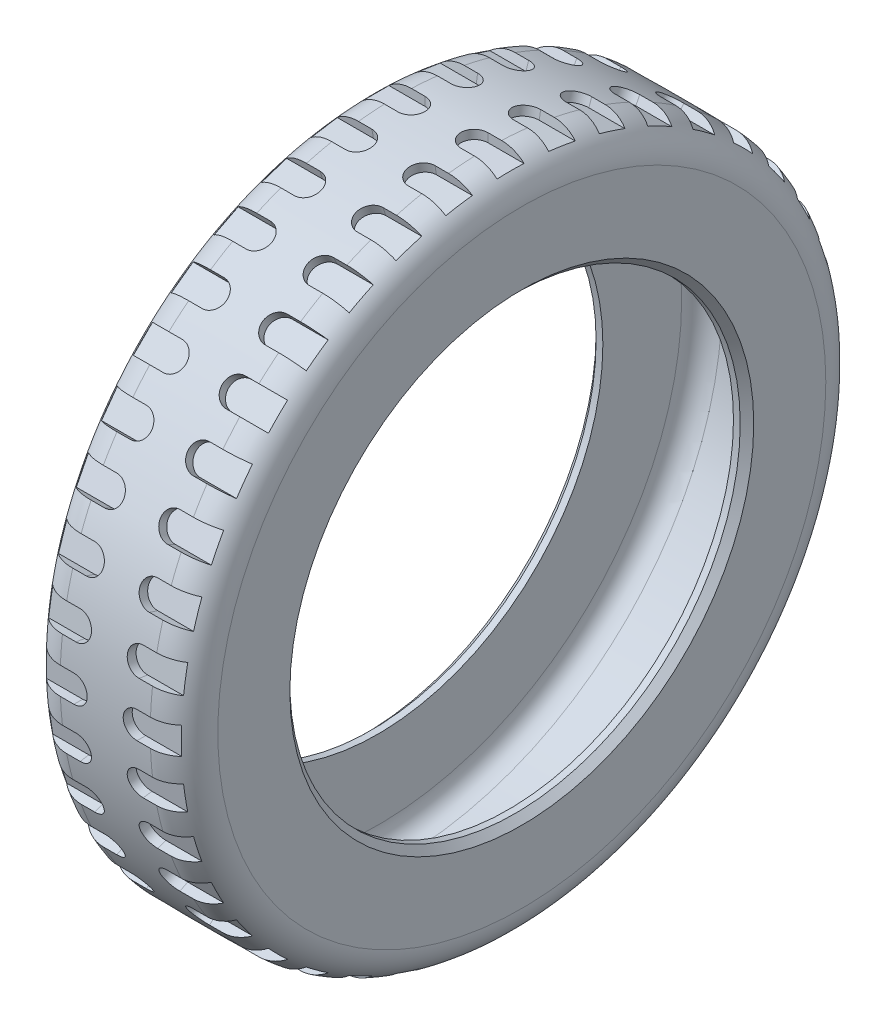
from build123d import *

# Parameters (mm, degrees)
PAH1_SIZE               = 1.5
KES_EKSTR_ZYON1_DEPTH   = 2
DAIRESEL_KAPLAMA1_COUNT = 40
AYNALAMA1_COPY_1_DEPTH  = 2
AYNALAMA1_COPY_2_DEPTH  = 2
AYNALAMA1_COPY_3_DEPTH  = 2
AYNALAMA1_COPY_4_DEPTH  = 2
AYNALAMA1_COPY_5_DEPTH  = 2
AYNALAMA1_COPY_6_DEPTH  = 2
AYNALAMA1_COPY_7_DEPTH  = 2
AYNALAMA1_COPY_8_DEPTH  = 2
AYNALAMA1_COPY_9_DEPTH  = 2
AYNALAMA1_COPY_10_DEPTH = 2
AYNALAMA1_COPY_11_DEPTH = 2
AYNALAMA1_COPY_12_DEPTH = 2
AYNALAMA1_COPY_13_DEPTH = 2
AYNALAMA1_COPY_14_DEPTH = 2
AYNALAMA1_COPY_15_DEPTH = 2
AYNALAMA1_COPY_16_DEPTH = 2
AYNALAMA1_COPY_17_DEPTH = 2
AYNALAMA1_COPY_18_DEPTH = 2
AYNALAMA1_COPY_19_DEPTH = 2
AYNALAMA1_COPY_20_DEPTH = 2
AYNALAMA1_COPY_21_DEPTH = 2
AYNALAMA1_COPY_22_DEPTH = 2
AYNALAMA1_COPY_23_DEPTH = 2
AYNALAMA1_COPY_24_DEPTH = 2
AYNALAMA1_COPY_25_DEPTH = 2
AYNALAMA1_COPY_26_DEPTH = 2
AYNALAMA1_COPY_27_DEPTH = 2
AYNALAMA1_COPY_28_DEPTH = 2
AYNALAMA1_COPY_29_DEPTH = 2
AYNALAMA1_COPY_30_DEPTH = 2
AYNALAMA1_COPY_31_DEPTH = 2
AYNALAMA1_COPY_32_DEPTH = 2
AYNALAMA1_COPY_33_DEPTH = 2
AYNALAMA1_COPY_34_DEPTH = 2
AYNALAMA1_COPY_35_DEPTH = 2
AYNALAMA1_COPY_36_DEPTH = 2
AYNALAMA1_COPY_37_DEPTH = 2
AYNALAMA1_COPY_38_DEPTH = 2
AYNALAMA1_COPY_39_DEPTH = 2
AYNALAMA1_COPY_40_DEPTH = 2


with BuildPart() as part:
    # Çizim1 → Döndür1 (revolve)
    with BuildSketch(Plane.XY):
        with BuildLine():
            Line((-17.5, 50), (-17.5, 67.5))
            ThreePointArc((-17.5, 67.5), (-15.303300859, 72.803300859), (-10, 75))
            Line((-10, 75), (10, 75))
            ThreePointArc((10, 75), (15.303300859, 72.803300859), (17.5, 67.5))
            Line((17.5, 67.5), (17.5, 50))
            Line((17.5, 50), (14.5, 50))
            Line((14.5, 50), (14.5, 67.5))
            ThreePointArc((14.5, 67.5), (13.181980515, 70.681980515), (10, 72))
            Line((10, 72), (-10, 72))
            ThreePointArc((-10, 72), (-13.181980515, 70.681980515), (-14.5, 67.5))
            Line((-14.5, 67.5), (-14.5, 50))
            Line((-14.5, 50), (-17.5, 50))
        make_face()
    revolve(axis=Axis((0, 0, 0), (-1, 0, 0)))

    # Pah1
    pah1_edges = [part.edges().sort_by_distance(p)[0] for p in [
        (-17.5, -50, 0),
        (17.5, -50, 0),
    ]]
    chamfer(pah1_edges, length=PAH1_SIZE)

    # Çizim2 → Kes-Ekstrüzyon1 (cut)
    with BuildSketch(Plane(origin=(0, 75, 0), x_dir=(1, 0, 0), z_dir=(0, 1, 0))):
        with BuildLine():
            Line((7, 3), (15, 3))
            Line((15, 3), (15, -3))
            Line((15, -3), (7, -3))
            ThreePointArc((7, -3), (4, 0), (7, 3))
        make_face()
    kes_ekstr_zyon1 = extrude(amount=-KES_EKSTR_ZYON1_DEPTH, mode=Mode.SUBTRACT)

    # Dairesel Kaplama1: Kes-Ekstrüzyon1 ×40 about axis
    dairesel_kaplama1_axis = Axis((14.5, 0, 0), (1, 0, 0))
    for i in range(1, DAIRESEL_KAPLAMA1_COUNT):
        add(kes_ekstr_zyon1.rotate(dairesel_kaplama1_axis, i * 360 / DAIRESEL_KAPLAMA1_COUNT), mode=Mode.SUBTRACT)

    # Aynalama1 copy 1 sketch → Aynalama1 copy 1 (cut)
    with BuildSketch(Plane(origin=(0, 74.076625545, 11.732584878), x_dir=(-1, 0, 0), z_dir=(0, 0.9876883405951378, 0.15643446504023087))):
        with BuildLine():
            Line((7, -3), (15, -3))
            Line((15, -3), (15, 3))
            Line((15, 3), (7, 3))
            ThreePointArc((7, 3), (4, 0), (7, -3))
        make_face()
    extrude(amount=-AYNALAMA1_COPY_1_DEPTH, mode=Mode.SUBTRACT)

    # Aynalama1 copy 2 sketch → Aynalama1 copy 2 (cut)
    with BuildSketch(Plane(origin=(0, 71.329238722, 23.176274578), x_dir=(-1, 0, 0), z_dir=(0, 0.9510565162951535, 0.3090169943749474))):
        with BuildLine():
            Line((7, -3), (15, -3))
            Line((15, -3), (15, 3))
            Line((15, 3), (7, 3))
            ThreePointArc((7, 3), (4, 0), (7, -3))
        make_face()
    extrude(amount=-AYNALAMA1_COPY_2_DEPTH, mode=Mode.SUBTRACT)

    # Aynalama1 copy 3 sketch → Aynalama1 copy 3 (cut)
    with BuildSketch(Plane(origin=(0, 66.825489314, 34.04928748), x_dir=(-1, 0, 0), z_dir=(0, 0.8910065241883679, 0.45399049973954675))):
        with BuildLine():
            Line((7, -3), (15, -3))
            Line((15, -3), (15, 3))
            Line((15, 3), (7, 3))
            ThreePointArc((7, 3), (4, 0), (7, -3))
        make_face()
    extrude(amount=-AYNALAMA1_COPY_3_DEPTH, mode=Mode.SUBTRACT)

    # Aynalama1 copy 4 sketch → Aynalama1 copy 4 (cut)
    with BuildSketch(Plane(origin=(0, 60.676274578, 44.083893922), x_dir=(-1, 0, 0), z_dir=(0, 0.8090169943749475, 0.5877852522924731))):
        with BuildLine():
            Line((7, -3), (15, -3))
            Line((15, -3), (15, 3))
            Line((15, 3), (7, 3))
            ThreePointArc((7, 3), (4, 0), (7, -3))
        make_face()
    extrude(amount=-AYNALAMA1_COPY_4_DEPTH, mode=Mode.SUBTRACT)

    # Aynalama1 copy 5 sketch → Aynalama1 copy 5 (cut)
    with BuildSketch(Plane(origin=(0, 53.033008589, 53.033008589), x_dir=(-1, 0, 0), z_dir=(0, 0.7071067811865476, 0.7071067811865475))):
        with BuildLine():
            Line((7, -3), (15, -3))
            Line((15, -3), (15, 3))
            Line((15, 3), (7, 3))
            ThreePointArc((7, 3), (4, 0), (7, -3))
        make_face()
    extrude(amount=-AYNALAMA1_COPY_5_DEPTH, mode=Mode.SUBTRACT)

    # Aynalama1 copy 6 sketch → Aynalama1 copy 6 (cut)
    with BuildSketch(Plane(origin=(0, 44.083893922, 60.676274578), x_dir=(-1, 0, 0), z_dir=(0, 0.5877852522924731, 0.8090169943749475))):
        with BuildLine():
            Line((7, -3), (15, -3))
            Line((15, -3), (15, 3))
            Line((15, 3), (7, 3))
            ThreePointArc((7, 3), (4, 0), (7, -3))
        make_face()
    extrude(amount=-AYNALAMA1_COPY_6_DEPTH, mode=Mode.SUBTRACT)

    # Aynalama1 copy 7 sketch → Aynalama1 copy 7 (cut)
    with BuildSketch(Plane(origin=(0, 34.04928748, 66.825489314), x_dir=(-1, 0, 0), z_dir=(0, 0.4539904997395468, 0.8910065241883678))):
        with BuildLine():
            Line((7, -3), (15, -3))
            Line((15, -3), (15, 3))
            Line((15, 3), (7, 3))
            ThreePointArc((7, 3), (4, 0), (7, -3))
        make_face()
    extrude(amount=-AYNALAMA1_COPY_7_DEPTH, mode=Mode.SUBTRACT)

    # Aynalama1 copy 8 sketch → Aynalama1 copy 8 (cut)
    with BuildSketch(Plane(origin=(0, 23.176274578, 71.329238722), x_dir=(-1, 0, 0), z_dir=(0, 0.30901699437494745, 0.9510565162951535))):
        with BuildLine():
            Line((7, -3), (15, -3))
            Line((15, -3), (15, 3))
            Line((15, 3), (7, 3))
            ThreePointArc((7, 3), (4, 0), (7, -3))
        make_face()
    extrude(amount=-AYNALAMA1_COPY_8_DEPTH, mode=Mode.SUBTRACT)

    # Aynalama1 copy 9 sketch → Aynalama1 copy 9 (cut)
    with BuildSketch(Plane(origin=(0, 11.732584878, 74.076625545), x_dir=(-1, 0, 0), z_dir=(0, 0.15643446504023092, 0.9876883405951378))):
        with BuildLine():
            Line((7, -3), (15, -3))
            Line((15, -3), (15, 3))
            Line((15, 3), (7, 3))
            ThreePointArc((7, 3), (4, 0), (7, -3))
        make_face()
    extrude(amount=-AYNALAMA1_COPY_9_DEPTH, mode=Mode.SUBTRACT)

    # Aynalama1 copy 10 sketch → Aynalama1 copy 10 (cut)
    with BuildSketch(Plane(origin=(0, 0, 75), x_dir=(-1, 0, 0), z_dir=(0, 0, 1))):
        with BuildLine():
            Line((7, -3), (15, -3))
            Line((15, -3), (15, 3))
            Line((15, 3), (7, 3))
            ThreePointArc((7, 3), (4, 0), (7, -3))
        make_face()
    extrude(amount=-AYNALAMA1_COPY_10_DEPTH, mode=Mode.SUBTRACT)

    # Aynalama1 copy 11 sketch → Aynalama1 copy 11 (cut)
    with BuildSketch(Plane(origin=(0, -11.732584878, 74.076625545), x_dir=(-1, 0, 0), z_dir=(0, -0.1564344650402308, 0.9876883405951378))):
        with BuildLine():
            Line((7, -3), (15, -3))
            Line((15, -3), (15, 3))
            Line((15, 3), (7, 3))
            ThreePointArc((7, 3), (4, 0), (7, -3))
        make_face()
    extrude(amount=-AYNALAMA1_COPY_11_DEPTH, mode=Mode.SUBTRACT)

    # Aynalama1 copy 12 sketch → Aynalama1 copy 12 (cut)
    with BuildSketch(Plane(origin=(0, -23.176274578, 71.329238722), x_dir=(-1, 0, 0), z_dir=(0, -0.30901699437494734, 0.9510565162951536))):
        with BuildLine():
            Line((7, -3), (15, -3))
            Line((15, -3), (15, 3))
            Line((15, 3), (7, 3))
            ThreePointArc((7, 3), (4, 0), (7, -3))
        make_face()
    extrude(amount=-AYNALAMA1_COPY_12_DEPTH, mode=Mode.SUBTRACT)

    # Aynalama1 copy 13 sketch → Aynalama1 copy 13 (cut)
    with BuildSketch(Plane(origin=(0, -34.04928748, 66.825489314), x_dir=(-1, 0, 0), z_dir=(0, -0.4539904997395467, 0.8910065241883679))):
        with BuildLine():
            Line((7, -3), (15, -3))
            Line((15, -3), (15, 3))
            Line((15, 3), (7, 3))
            ThreePointArc((7, 3), (4, 0), (7, -3))
        make_face()
    extrude(amount=-AYNALAMA1_COPY_13_DEPTH, mode=Mode.SUBTRACT)

    # Aynalama1 copy 14 sketch → Aynalama1 copy 14 (cut)
    with BuildSketch(Plane(origin=(0, -44.083893922, 60.676274578), x_dir=(-1, 0, 0), z_dir=(0, -0.587785252292473, 0.8090169943749475))):
        with BuildLine():
            Line((7, -3), (15, -3))
            Line((15, -3), (15, 3))
            Line((15, 3), (7, 3))
            ThreePointArc((7, 3), (4, 0), (7, -3))
        make_face()
    extrude(amount=-AYNALAMA1_COPY_14_DEPTH, mode=Mode.SUBTRACT)

    # Aynalama1 copy 15 sketch → Aynalama1 copy 15 (cut)
    with BuildSketch(Plane(origin=(0, -53.033008589, 53.033008589), x_dir=(-1, 0, 0), z_dir=(0, -0.7071067811865475, 0.7071067811865476))):
        with BuildLine():
            Line((7, -3), (15, -3))
            Line((15, -3), (15, 3))
            Line((15, 3), (7, 3))
            ThreePointArc((7, 3), (4, 0), (7, -3))
        make_face()
    extrude(amount=-AYNALAMA1_COPY_15_DEPTH, mode=Mode.SUBTRACT)

    # Aynalama1 copy 16 sketch → Aynalama1 copy 16 (cut)
    with BuildSketch(Plane(origin=(0, -60.676274578, 44.083893922), x_dir=(-1, 0, 0), z_dir=(0, -0.8090169943749473, 0.5877852522924732))):
        with BuildLine():
            Line((7, -3), (15, -3))
            Line((15, -3), (15, 3))
            Line((15, 3), (7, 3))
            ThreePointArc((7, 3), (4, 0), (7, -3))
        make_face()
    extrude(amount=-AYNALAMA1_COPY_16_DEPTH, mode=Mode.SUBTRACT)

    # Aynalama1 copy 17 sketch → Aynalama1 copy 17 (cut)
    with BuildSketch(Plane(origin=(0, -66.825489314, 34.04928748), x_dir=(-1, 0, 0), z_dir=(0, -0.8910065241883678, 0.45399049973954686))):
        with BuildLine():
            Line((7, -3), (15, -3))
            Line((15, -3), (15, 3))
            Line((15, 3), (7, 3))
            ThreePointArc((7, 3), (4, 0), (7, -3))
        make_face()
    extrude(amount=-AYNALAMA1_COPY_17_DEPTH, mode=Mode.SUBTRACT)

    # Aynalama1 copy 18 sketch → Aynalama1 copy 18 (cut)
    with BuildSketch(Plane(origin=(0, -71.329238722, 23.176274578), x_dir=(-1, 0, 0), z_dir=(0, -0.9510565162951535, 0.3090169943749475))):
        with BuildLine():
            Line((7, -3), (15, -3))
            Line((15, -3), (15, 3))
            Line((15, 3), (7, 3))
            ThreePointArc((7, 3), (4, 0), (7, -3))
        make_face()
    extrude(amount=-AYNALAMA1_COPY_18_DEPTH, mode=Mode.SUBTRACT)

    # Aynalama1 copy 19 sketch → Aynalama1 copy 19 (cut)
    with BuildSketch(Plane(origin=(0, -74.076625545, 11.732584878), x_dir=(-1, 0, 0), z_dir=(0, -0.9876883405951377, 0.15643446504023098))):
        with BuildLine():
            Line((7, -3), (15, -3))
            Line((15, -3), (15, 3))
            Line((15, 3), (7, 3))
            ThreePointArc((7, 3), (4, 0), (7, -3))
        make_face()
    extrude(amount=-AYNALAMA1_COPY_19_DEPTH, mode=Mode.SUBTRACT)

    # Aynalama1 copy 20 sketch → Aynalama1 copy 20 (cut)
    with BuildSketch(Plane(origin=(0, -75, 0), x_dir=(-1, 0, 0), z_dir=(0, -1, 0))):
        with BuildLine():
            Line((7, -3), (15, -3))
            Line((15, -3), (15, 3))
            Line((15, 3), (7, 3))
            ThreePointArc((7, 3), (4, 0), (7, -3))
        make_face()
    extrude(amount=-AYNALAMA1_COPY_20_DEPTH, mode=Mode.SUBTRACT)

    # Aynalama1 copy 21 sketch → Aynalama1 copy 21 (cut)
    with BuildSketch(Plane(origin=(0, -74.076625545, -11.732584878), x_dir=(-1, 0, 0), z_dir=(0, -0.9876883405951378, -0.15643446504023073))):
        with BuildLine():
            Line((7, -3), (15, -3))
            Line((15, -3), (15, 3))
            Line((15, 3), (7, 3))
            ThreePointArc((7, 3), (4, 0), (7, -3))
        make_face()
    extrude(amount=-AYNALAMA1_COPY_21_DEPTH, mode=Mode.SUBTRACT)

    # Aynalama1 copy 22 sketch → Aynalama1 copy 22 (cut)
    with BuildSketch(Plane(origin=(0, -71.329238722, -23.176274578), x_dir=(-1, 0, 0), z_dir=(0, -0.9510565162951536, -0.3090169943749473))):
        with BuildLine():
            Line((7, -3), (15, -3))
            Line((15, -3), (15, 3))
            Line((15, 3), (7, 3))
            ThreePointArc((7, 3), (4, 0), (7, -3))
        make_face()
    extrude(amount=-AYNALAMA1_COPY_22_DEPTH, mode=Mode.SUBTRACT)

    # Aynalama1 copy 23 sketch → Aynalama1 copy 23 (cut)
    with BuildSketch(Plane(origin=(0, -66.825489314, -34.04928748), x_dir=(-1, 0, 0), z_dir=(0, -0.8910065241883679, -0.4539904997395467))):
        with BuildLine():
            Line((7, -3), (15, -3))
            Line((15, -3), (15, 3))
            Line((15, 3), (7, 3))
            ThreePointArc((7, 3), (4, 0), (7, -3))
        make_face()
    extrude(amount=-AYNALAMA1_COPY_23_DEPTH, mode=Mode.SUBTRACT)

    # Aynalama1 copy 24 sketch → Aynalama1 copy 24 (cut)
    with BuildSketch(Plane(origin=(0, -60.676274578, -44.083893922), x_dir=(-1, 0, 0), z_dir=(0, -0.8090169943749476, -0.587785252292473))):
        with BuildLine():
            Line((7, -3), (15, -3))
            Line((15, -3), (15, 3))
            Line((15, 3), (7, 3))
            ThreePointArc((7, 3), (4, 0), (7, -3))
        make_face()
    extrude(amount=-AYNALAMA1_COPY_24_DEPTH, mode=Mode.SUBTRACT)

    # Aynalama1 copy 25 sketch → Aynalama1 copy 25 (cut)
    with BuildSketch(Plane(origin=(0, -53.033008589, -53.033008589), x_dir=(-1, 0, 0), z_dir=(0, -0.7071067811865477, -0.7071067811865475))):
        with BuildLine():
            Line((7, -3), (15, -3))
            Line((15, -3), (15, 3))
            Line((15, 3), (7, 3))
            ThreePointArc((7, 3), (4, 0), (7, -3))
        make_face()
    extrude(amount=-AYNALAMA1_COPY_25_DEPTH, mode=Mode.SUBTRACT)

    # Aynalama1 copy 26 sketch → Aynalama1 copy 26 (cut)
    with BuildSketch(Plane(origin=(0, -44.083893922, -60.676274578), x_dir=(-1, 0, 0), z_dir=(0, -0.5877852522924732, -0.8090169943749473))):
        with BuildLine():
            Line((7, -3), (15, -3))
            Line((15, -3), (15, 3))
            Line((15, 3), (7, 3))
            ThreePointArc((7, 3), (4, 0), (7, -3))
        make_face()
    extrude(amount=-AYNALAMA1_COPY_26_DEPTH, mode=Mode.SUBTRACT)

    # Aynalama1 copy 27 sketch → Aynalama1 copy 27 (cut)
    with BuildSketch(Plane(origin=(0, -34.04928748, -66.825489314), x_dir=(-1, 0, 0), z_dir=(0, -0.4539904997395469, -0.8910065241883678))):
        with BuildLine():
            Line((7, -3), (15, -3))
            Line((15, -3), (15, 3))
            Line((15, 3), (7, 3))
            ThreePointArc((7, 3), (4, 0), (7, -3))
        make_face()
    extrude(amount=-AYNALAMA1_COPY_27_DEPTH, mode=Mode.SUBTRACT)

    # Aynalama1 copy 28 sketch → Aynalama1 copy 28 (cut)
    with BuildSketch(Plane(origin=(0, -23.176274578, -71.329238722), x_dir=(-1, 0, 0), z_dir=(0, -0.30901699437494756, -0.9510565162951535))):
        with BuildLine():
            Line((7, -3), (15, -3))
            Line((15, -3), (15, 3))
            Line((15, 3), (7, 3))
            ThreePointArc((7, 3), (4, 0), (7, -3))
        make_face()
    extrude(amount=-AYNALAMA1_COPY_28_DEPTH, mode=Mode.SUBTRACT)

    # Aynalama1 copy 29 sketch → Aynalama1 copy 29 (cut)
    with BuildSketch(Plane(origin=(0, -11.732584878, -74.076625545), x_dir=(-1, 0, 0), z_dir=(0, -0.15643446504023104, -0.9876883405951377))):
        with BuildLine():
            Line((7, -3), (15, -3))
            Line((15, -3), (15, 3))
            Line((15, 3), (7, 3))
            ThreePointArc((7, 3), (4, 0), (7, -3))
        make_face()
    extrude(amount=-AYNALAMA1_COPY_29_DEPTH, mode=Mode.SUBTRACT)

    # Aynalama1 copy 30 sketch → Aynalama1 copy 30 (cut)
    with BuildSketch(Plane(origin=(0, 0, -75), x_dir=(-1, 0, 0), z_dir=(0, 0, -1))):
        with BuildLine():
            Line((7, -3), (15, -3))
            Line((15, -3), (15, 3))
            Line((15, 3), (7, 3))
            ThreePointArc((7, 3), (4, 0), (7, -3))
        make_face()
    extrude(amount=-AYNALAMA1_COPY_30_DEPTH, mode=Mode.SUBTRACT)

    # Aynalama1 copy 31 sketch → Aynalama1 copy 31 (cut)
    with BuildSketch(Plane(origin=(0, 11.732584878, -74.076625545), x_dir=(-1, 0, 0), z_dir=(0, 0.15643446504023067, -0.9876883405951378))):
        with BuildLine():
            Line((7, -3), (15, -3))
            Line((15, -3), (15, 3))
            Line((15, 3), (7, 3))
            ThreePointArc((7, 3), (4, 0), (7, -3))
        make_face()
    extrude(amount=-AYNALAMA1_COPY_31_DEPTH, mode=Mode.SUBTRACT)

    # Aynalama1 copy 32 sketch → Aynalama1 copy 32 (cut)
    with BuildSketch(Plane(origin=(0, 23.176274578, -71.329238722), x_dir=(-1, 0, 0), z_dir=(0, 0.30901699437494723, -0.9510565162951536))):
        with BuildLine():
            Line((7, -3), (15, -3))
            Line((15, -3), (15, 3))
            Line((15, 3), (7, 3))
            ThreePointArc((7, 3), (4, 0), (7, -3))
        make_face()
    extrude(amount=-AYNALAMA1_COPY_32_DEPTH, mode=Mode.SUBTRACT)

    # Aynalama1 copy 33 sketch → Aynalama1 copy 33 (cut)
    with BuildSketch(Plane(origin=(0, 34.04928748, -66.825489314), x_dir=(-1, 0, 0), z_dir=(0, 0.45399049973954664, -0.891006524188368))):
        with BuildLine():
            Line((7, -3), (15, -3))
            Line((15, -3), (15, 3))
            Line((15, 3), (7, 3))
            ThreePointArc((7, 3), (4, 0), (7, -3))
        make_face()
    extrude(amount=-AYNALAMA1_COPY_33_DEPTH, mode=Mode.SUBTRACT)

    # Aynalama1 copy 34 sketch → Aynalama1 copy 34 (cut)
    with BuildSketch(Plane(origin=(0, 44.083893922, -60.676274578), x_dir=(-1, 0, 0), z_dir=(0, 0.5877852522924729, -0.8090169943749476))):
        with BuildLine():
            Line((7, -3), (15, -3))
            Line((15, -3), (15, 3))
            Line((15, 3), (7, 3))
            ThreePointArc((7, 3), (4, 0), (7, -3))
        make_face()
    extrude(amount=-AYNALAMA1_COPY_34_DEPTH, mode=Mode.SUBTRACT)

    # Aynalama1 copy 35 sketch → Aynalama1 copy 35 (cut)
    with BuildSketch(Plane(origin=(0, 53.033008589, -53.033008589), x_dir=(-1, 0, 0), z_dir=(0, 0.7071067811865474, -0.7071067811865477))):
        with BuildLine():
            Line((7, -3), (15, -3))
            Line((15, -3), (15, 3))
            Line((15, 3), (7, 3))
            ThreePointArc((7, 3), (4, 0), (7, -3))
        make_face()
    extrude(amount=-AYNALAMA1_COPY_35_DEPTH, mode=Mode.SUBTRACT)

    # Aynalama1 copy 36 sketch → Aynalama1 copy 36 (cut)
    with BuildSketch(Plane(origin=(0, 60.676274578, -44.083893922), x_dir=(-1, 0, 0), z_dir=(0, 0.8090169943749473, -0.5877852522924734))):
        with BuildLine():
            Line((7, -3), (15, -3))
            Line((15, -3), (15, 3))
            Line((15, 3), (7, 3))
            ThreePointArc((7, 3), (4, 0), (7, -3))
        make_face()
    extrude(amount=-AYNALAMA1_COPY_36_DEPTH, mode=Mode.SUBTRACT)

    # Aynalama1 copy 37 sketch → Aynalama1 copy 37 (cut)
    with BuildSketch(Plane(origin=(0, 66.825489314, -34.04928748), x_dir=(-1, 0, 0), z_dir=(0, 0.8910065241883678, -0.45399049973954697))):
        with BuildLine():
            Line((7, -3), (15, -3))
            Line((15, -3), (15, 3))
            Line((15, 3), (7, 3))
            ThreePointArc((7, 3), (4, 0), (7, -3))
        make_face()
    extrude(amount=-AYNALAMA1_COPY_37_DEPTH, mode=Mode.SUBTRACT)

    # Aynalama1 copy 38 sketch → Aynalama1 copy 38 (cut)
    with BuildSketch(Plane(origin=(0, 71.329238722, -23.176274578), x_dir=(-1, 0, 0), z_dir=(0, 0.9510565162951535, -0.3090169943749476))):
        with BuildLine():
            Line((7, -3), (15, -3))
            Line((15, -3), (15, 3))
            Line((15, 3), (7, 3))
            ThreePointArc((7, 3), (4, 0), (7, -3))
        make_face()
    extrude(amount=-AYNALAMA1_COPY_38_DEPTH, mode=Mode.SUBTRACT)

    # Aynalama1 copy 39 sketch → Aynalama1 copy 39 (cut)
    with BuildSketch(Plane(origin=(0, 74.076625545, -11.732584878), x_dir=(-1, 0, 0), z_dir=(0, 0.9876883405951377, -0.15643446504023112))):
        with BuildLine():
            Line((7, -3), (15, -3))
            Line((15, -3), (15, 3))
            Line((15, 3), (7, 3))
            ThreePointArc((7, 3), (4, 0), (7, -3))
        make_face()
    extrude(amount=-AYNALAMA1_COPY_39_DEPTH, mode=Mode.SUBTRACT)

    # Aynalama1 copy 40 sketch → Aynalama1 copy 40 (cut)
    with BuildSketch(Plane(origin=(0, 75, 0), x_dir=(-1, 0, 0), z_dir=(0, 1, 0))):
        with BuildLine():
            Line((7, -3), (15, -3))
            Line((15, -3), (15, 3))
            Line((15, 3), (7, 3))
            ThreePointArc((7, 3), (4, 0), (7, -3))
        make_face()
    extrude(amount=-AYNALAMA1_COPY_40_DEPTH, mode=Mode.SUBTRACT)


solid = part.part
